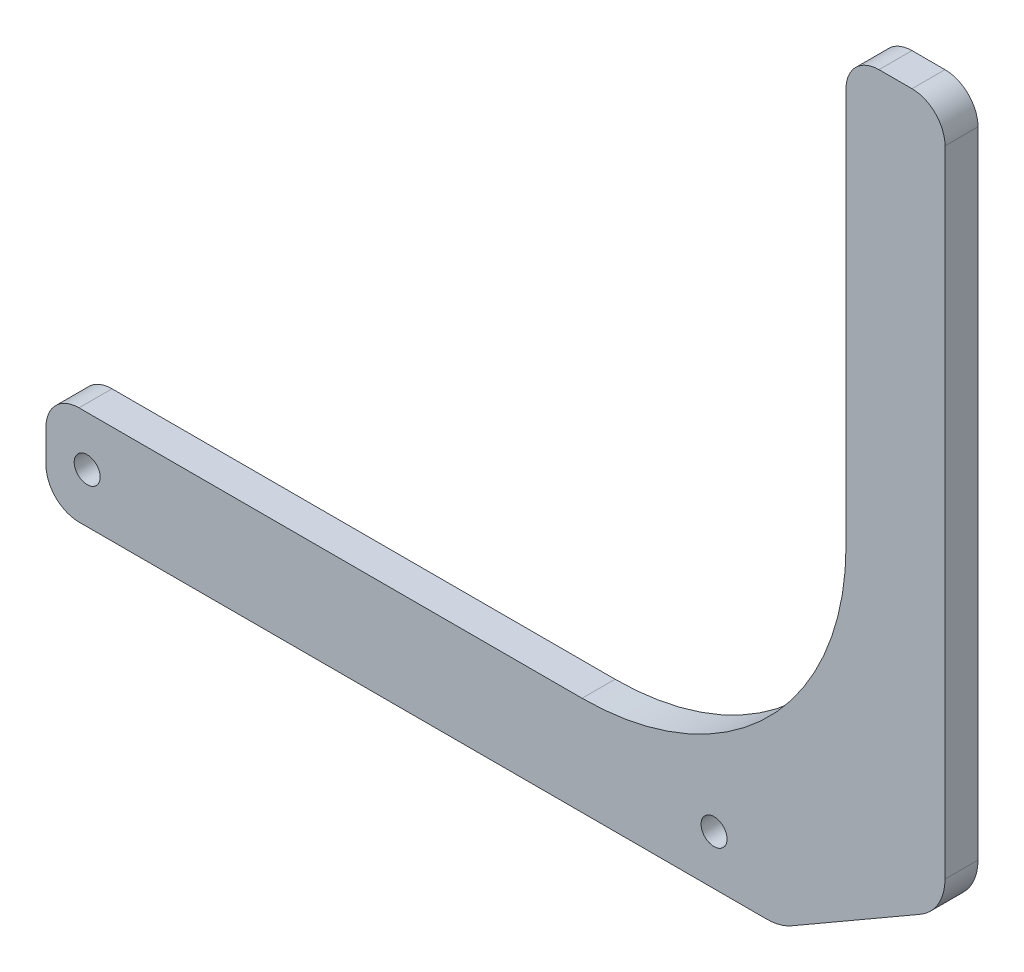
from build123d import *

# Parameters (mm, degrees)
BASE_FLANGE1_DEPTH    = 6.35
M6X1_0_TAPPED_HOLE1_D = 5
CHAMFER1_SIZE         = 31.75
CHAMFER1_SIZE2        = 18.330871047
EXTRUDE1_REACH        = 170.395
SKETCH5_W             = 4.7752
SKETCH5_H             = 19.05
FILLET1_R             = 6.35
FILLET2_R             = 50.8
FILLET3_R             = 9.525


# Sheet-metal steps are written as plain solids
with BuildPart() as part:
    # Sketch1 → Base-Flange1 (new body)
    with BuildSketch(Plane.XY):
        Polygon((-88.9, 9.525), (69.85, 9.525), (69.85, 142.875), (88.9, 142.875), (88.9, 9.525), (88.9, -9.525), (-88.9, -9.525), align=None)
    extrude(amount=BASE_FLANGE1_DEPTH)

    # M6x1.0 Tapped Hole1 (through all)
    with Locations(Plane.XY.offset(6.35)):
        with Locations((-76.2, 0), (44.45, 0)):
            Hole(M6X1_0_TAPPED_HOLE1_D / 2)

    # Chamfer1
    chamfer1_edges = [part.edges().sort_by_distance(p)[0] for p in [
        (88.9, -9.525, 3.175),
    ]]
    chamfer1_side = [part.faces().sort_by_distance(p)[0] for p in [
        (0, -9.525, 3.175),
    ]]
    chamfer(chamfer1_edges, length=CHAMFER1_SIZE, length2=CHAMFER1_SIZE2, reference=chamfer1_side[0])

    # Sketch5 → Extrude1 (cut, up to next)
    with BuildSketch(Plane.XY.offset(6.35), mode=Mode.PRIVATE) as extrude1_sk1:
        with Locations((-86.5124, 0)):
            Rectangle(SKETCH5_W, SKETCH5_H)
    extrude1_tool1 = extrude(extrude1_sk1.sketch, amount=-EXTRUDE1_REACH, mode=Mode.PRIVATE) & part.part
    add(extrude1_tool1.solids().sort_by_distance((-86.5124, 0, 6.35))[0], mode=Mode.SUBTRACT)

    # Fillet1
    fillet1_edges = [part.edges().sort_by_distance(p)[0] for p in [
        (69.85, 142.875, 3.175),
        (88.9, 142.875, 3.175),
        (-84.1248, 9.525, 3.175),
        (-84.1248, -9.525, 3.175),
    ]]
    fillet(fillet1_edges, radius=FILLET1_R)

    # Fillet2
    fillet2_edges = [part.edges().sort_by_distance(p)[0] for p in [
        (69.85, 9.525, 3.175),
    ]]
    fillet(fillet2_edges, radius=FILLET2_R)

    # Fillet3
    fillet3_edges = [part.edges().sort_by_distance(p)[0] for p in [
        (88.9, 8.805871047, 3.175),
        (57.15, -9.525, 3.175),
    ]]
    fillet(fillet3_edges, radius=FILLET3_R)


solid = part.part
